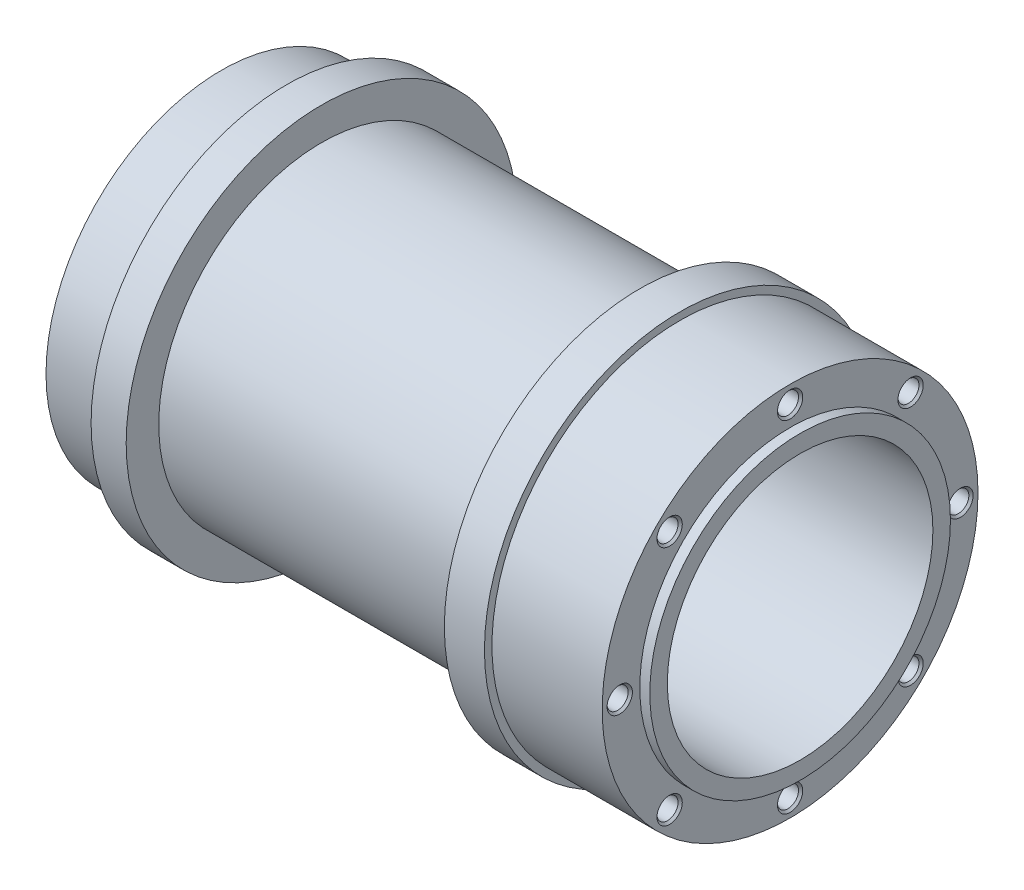
from build123d import *

# Parameters (mm, degrees)
OTW_R_GWINTOWANY_M51_D           = 4.2
OTW_R_GWINTOWANY_M51_DEPTH       = 16
OTW_R_GWINTOWANY_M51_CSINK_D     = 5.05
OTW_R_GWINTOWANY_M51_CSINK_ANGLE = 90
OTW_R_GWINTOWANY_M51_TIP         = 1.2618073


with BuildPart() as part:
    # Szkic1 → Obrót1 (revolve)
    with BuildSketch(Plane.XY):
        Polygon((-115.499999821, 16), (-115.499999821, 35), (-102.5, 35), (-102.5, 39), (-95.499999821, 39), (-95.499999821, 32.5), (-32, 32.5), (-32, 39), (-24, 39), (-24, 37.5), (-2, 37.5), (-2, 30), (0, 30), (0, 26.5), (-111.499999821, 26.5), (-111.499999821, 16), align=None)
    revolve(axis=Axis((0, 0, 0), (-1, 0, 0)))

    # Otwór gwintowany M51
    with Locations(Plane(origin=(-2, 0, 0), x_dir=(0, 0, -1), z_dir=(1, 0, 0))):
        with Locations((34, 0), (0, 0), (24.04163056, -24.04163056), (0, -34), (-24.04163056, -24.04163056), (-34, 0), (-24.04163056, 24.04163056), (0, 34), (24.04163056, 24.04163056)):
            CounterSinkHole(OTW_R_GWINTOWANY_M51_D / 2, OTW_R_GWINTOWANY_M51_CSINK_D / 2, depth=OTW_R_GWINTOWANY_M51_DEPTH, counter_sink_angle=OTW_R_GWINTOWANY_M51_CSINK_ANGLE)
            with Locations((0, 0, -(OTW_R_GWINTOWANY_M51_DEPTH + OTW_R_GWINTOWANY_M51_TIP / 2))):  # 118° drill point
                Cone(0, OTW_R_GWINTOWANY_M51_D / 2, OTW_R_GWINTOWANY_M51_TIP, mode=Mode.SUBTRACT)


solid = part.part
